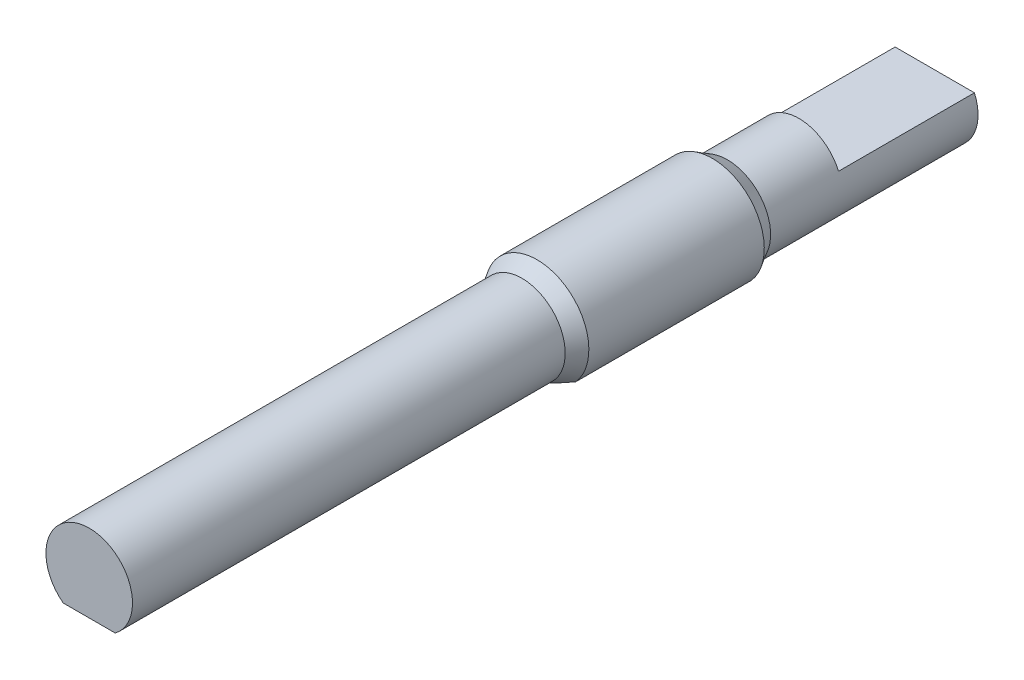
from build123d import *

# Parameters (mm, degrees)
SKETCH1_R           = 2.5
BOSS_EXTRUDE1_DEPTH = 25
SKETCH2_R           = 3
BOSS_EXTRUDE2_DEPTH = 11
CHAMFER1_SIZE2      = 0.5
CHAMFER1_SIZE       = 0.866025404
BOSS_EXTRUDE3_START = 5
SKETCH3_R           = 2.5
BOSS_EXTRUDE3_DEPTH = 5
CHAMFER3_SIZE2      = 0.866025404
CHAMFER3_SIZE       = 0.5
BOSS_EXTRUDE4_START = 7.85
BOSS_EXTRUDE4_DEPTH = 7.85


with BuildPart() as part:
    # Sketch1 → Boss-Extrude1 (new body)
    with BuildSketch(Plane.XY):
        Circle(SKETCH1_R)
    extrude(amount=BOSS_EXTRUDE1_DEPTH)

    # Sketch2 → Boss-Extrude2 (add)
    with BuildSketch(Plane(origin=(0, 0, 0), x_dir=(-1, 0, 0), z_dir=(0, 0, -1))):
        Circle(SKETCH2_R)
    extrude(amount=BOSS_EXTRUDE2_DEPTH)

    # Chamfer1
    chamfer1_edges = [part.edges().sort_by_distance(p)[0] for p in [
        (3, 0, 0),
    ]]
    chamfer1_side = [part.faces().sort_by_distance(p)[0] for p in [
        (3, 0, -0.01),
    ]]
    chamfer(chamfer1_edges, length=CHAMFER1_SIZE - 0.0001, length2=CHAMFER1_SIZE2 - 0.0001, reference=chamfer1_side[0])  # a hair under: the kernel refuses the full size

    # Sketch3 → Boss-Extrude3 (add)
    with BuildSketch(Plane(origin=(0, 0, -11), x_dir=(-1, 0, 0), z_dir=(0, 0, -1)).offset(BOSS_EXTRUDE3_START)):
        with Locations(Location((0, 0, 0), (0, 0, 180))):
            Circle(SKETCH3_R)
    extrude(amount=-BOSS_EXTRUDE3_DEPTH)

    # Chamfer3
    chamfer3_edges = [part.edges().sort_by_distance(p)[0] for p in [
        (-2.5, 0, -11),
    ]]
    chamfer3_side = [part.faces().sort_by_distance(p)[0] for p in [
        (-2.51, 0, -11),
    ]]
    chamfer(chamfer3_edges, length=CHAMFER3_SIZE - 0.0001, length2=CHAMFER3_SIZE2 - 0.0001, reference=chamfer3_side[0])  # a hair under: the kernel refuses the full size

    # Sketch4 → Boss-Extrude4 (add)
    with BuildSketch(Plane(origin=(0, 0, -16), x_dir=(-1, 0, 0), z_dir=(0, 0, -1)).offset(BOSS_EXTRUDE4_START)):
        with BuildLine():
            Line((-2.291287847, 1), (2.291287847, 1))
            ThreePointArc((2.291287847, 1), (0, -2.5), (-2.291287847, 1))
        make_face()
    extrude(amount=-BOSS_EXTRUDE4_DEPTH)

    # SurfaceCut1
    split(bisect_by=Plane(origin=(0, -2, 0), x_dir=(1, 0, 0), z_dir=(0, 1, 0)), keep=Keep.TOP)


solid = part.part
